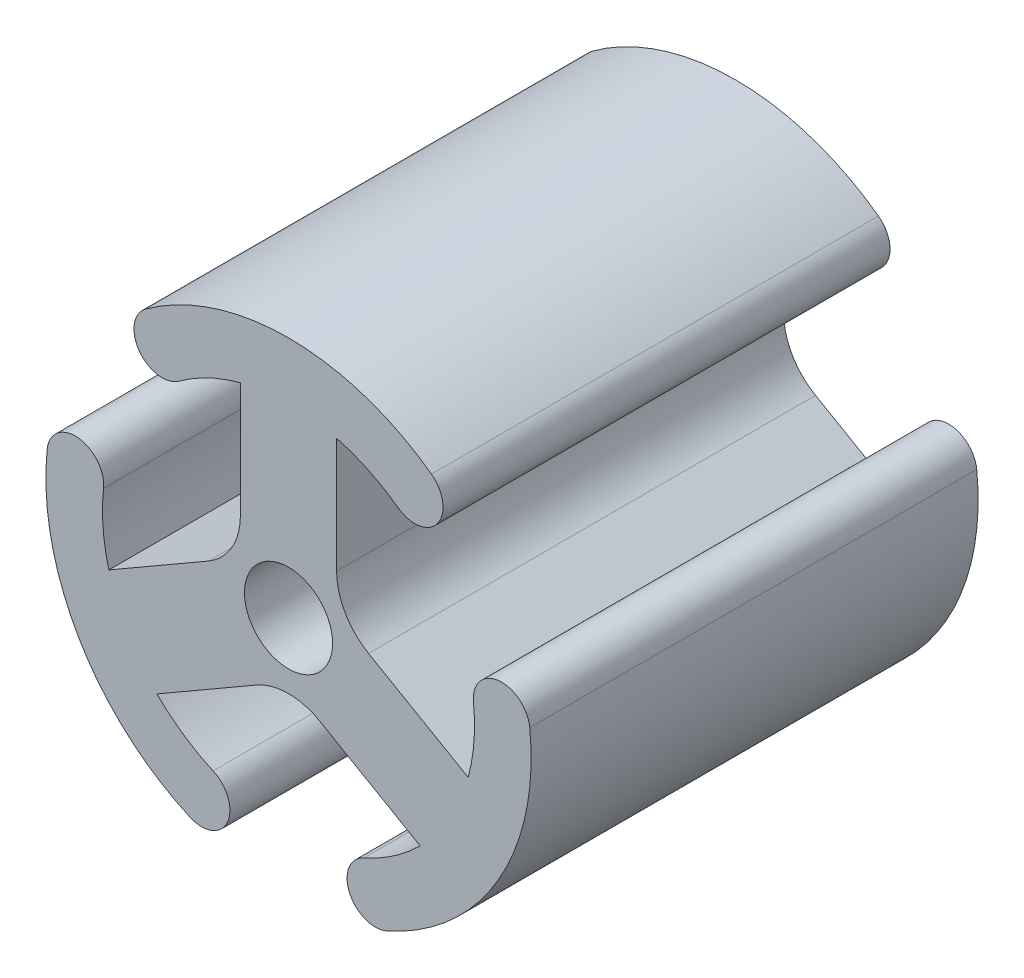
from build123d import *

# Parameters (mm, degrees)
BOSS_EXTRUDE3_DEPTH = 35
CIRPATTERN1_COUNT   = 3
FILLET1_R           = 5
SKETCH6_R           = 3.45
CUT_EXTRUDE1_DEPTH  = 50


with BuildPart() as part:
    # Sketch2 → Boss-Extrude3 (new body)
    with BuildSketch(Plane.XY):
        with BuildLine():
            ThreePointArc((-11.191746167, 15.353983774), (-11.677300028, 12.257240413), (-8.580556666, 11.771686551))
            ThreePointArc((-8.580556666, 11.771686551), (-6.280006751, 13.143822586), (-3.767104533, 14.071513081))
            Line((-3.767104533, 14.071513081), (-3.767104533, 0))
            Line((-3.767104533, 0), (3.767104533, 0))
            Line((3.767104533, 0), (3.767104533, 14.071513081))
            ThreePointArc((3.767104533, 14.071513081), (6.280006751, 13.143822586), (8.580556666, 11.771686551))
            ThreePointArc((8.580556666, 11.771686551), (11.677300028, 12.257240413), (11.191746167, 15.353983774))
            ThreePointArc((11.191746167, 15.353983774), (0, 19), (-11.191746167, 15.353983774))
        make_face()
    extrude(amount=-BOSS_EXTRUDE3_DEPTH)

    # CirPattern1: part ×3 about axis
    cirpattern1_axis = Axis((0, 0, 0), (0, 0, -1))


with BuildPart() as part_1:
    add(part.part)
    for i in range(1, CIRPATTERN1_COUNT):
        add(part.part.rotate(cirpattern1_axis, i * 360 / CIRPATTERN1_COUNT))

    # Fillet1
    fillet1_edges = [part_1.edges().sort_by_distance(p)[0] for p in [
        (3.767104533, 2.174938816, -17.5),
        (0, -4.349877632, -17.5),
        (-3.767104533, 2.174938816, -17.5),
    ]]
    fillet(fillet1_edges, radius=FILLET1_R)

    # Sketch6 → Cut-Extrude1 (cut)
    with BuildSketch(Plane(origin=(0, 0, -35), x_dir=(-1, 0, 0), z_dir=(0, 0, -1))):
        Circle(SKETCH6_R)
    extrude(amount=-CUT_EXTRUDE1_DEPTH, mode=Mode.SUBTRACT)


solid = part_1.part
